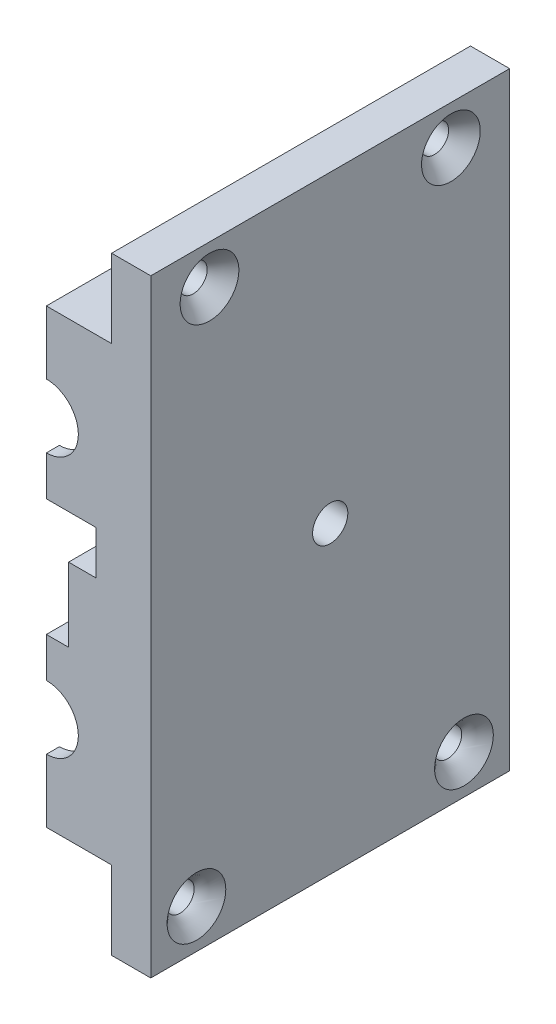
from build123d import *

# Parameters (mm, degrees)
BOSS_EXTRUDE1_DEPTH = 55
BOSS_EXTRUDE2_START = 2
BOSS_EXTRUDE2_DEPTH = 2
BOSS_EXTRUDE3_START = 2
BOSS_EXTRUDE3_DEPTH = 2
BOSS_EXTRUDE5_START = 2
BOSS_EXTRUDE5_DEPTH = 2
BOSS_EXTRUDE6_DEPTH = 2
SKETCH7_W           = 3.4
SKETCH7_H           = 11.3
CUT_EXTRUDE2_DEPTH  = 55
SKETCH8_R           = 2.15
CUT_EXTRUDE3_DEPTH  = 6
CUT_EXTRUDE4_REACH  = 111.395
SKETCH9_R           = 2.7
LPATTERN1_COUNT     = 2
LPATTERN1_PITCH     = 37
LPATTERN2_COUNT     = 2
LPATTERN2_PITCH     = 41


with BuildPart() as part:
    # Sketch1 → Boss-Extrude1 (new body)
    with BuildSketch(Plane.XY):
        with BuildLine():
            Line((0, 0), (0, -93.2))
            Line((0, -93.2), (-6, -93.2))
            Line((-6, -93.2), (-6, -81.2))
            Line((-6, -81.2), (-16, -81.2))
            Line((-16, -81.2), (-16, -74.2))
            ThreePointArc((-16, -74.2), (-8.4, -66.6), (-16, -59))
            Line((-16, -59), (-16, -44.3))
            Line((-16, -44.3), (-8.4, -44.3))
            Line((-8.4, -44.3), (-8.4, -37.6))
            Line((-8.4, -37.6), (-16, -37.6))
            Line((-16, -37.6), (-16, -34.2))
            ThreePointArc((-16, -34.2), (-8.4, -26.6), (-16, -19))
            Line((-16, -19), (-16, -12))
            Line((-16, -12), (-6, -12))
            Line((-6, -12), (-6, 0))
            Line((-6, 0), (0, 0))
        make_face()
    extrude(amount=BOSS_EXTRUDE1_DEPTH)

    # Sketch2 → Boss-Extrude2 (add)
    with BuildSketch(Plane(origin=(0, 0, 28.5), x_dir=(-1, 0, 0), z_dir=(0, 0, -1)).offset(BOSS_EXTRUDE2_START)):
        with BuildLine():
            Line((16, -34.2), (16, -31.5))
            ThreePointArc((16, -31.5), (11.1, -26.6), (16, -21.7))
            Line((16, -21.7), (16, -19))
            ThreePointArc((16, -19), (8.4, -26.6), (16, -34.2))
        make_face()
    extrude(amount=-BOSS_EXTRUDE2_DEPTH)

    # Sketch3 → Boss-Extrude3 (add)
    with BuildSketch(Plane(origin=(0, 0, 28.5), x_dir=(-1, 0, 0), z_dir=(0, 0, -1)).offset(BOSS_EXTRUDE3_START)):
        with BuildLine():
            Line((16, -74.2), (16, -71.5))
            ThreePointArc((16, -71.5), (11.1, -66.6), (16, -61.7))
            Line((16, -61.7), (16, -59))
            ThreePointArc((16, -59), (8.4, -66.6), (16, -74.2))
        make_face()
    extrude(amount=-BOSS_EXTRUDE3_DEPTH)

    # Sketch4 → Boss-Extrude5 (add)
    with BuildSketch(Plane(origin=(0, 0, 2), x_dir=(-1, 0, 0), z_dir=(0, 0, -1)).offset(BOSS_EXTRUDE5_START)):
        with BuildLine():
            Line((16, -59), (16, -61.7))
            ThreePointArc((16, -61.7), (11.1, -66.6), (16, -71.5))
            Line((16, -71.5), (16, -74.2))
            ThreePointArc((16, -74.2), (8.4, -66.6), (16, -59))
        make_face()
        with BuildLine():
            Line((16, -19), (16, -21.7))
            ThreePointArc((16, -21.7), (11.1, -26.6), (16, -31.5))
            Line((16, -31.5), (16, -34.2))
            ThreePointArc((16, -34.2), (8.4, -26.6), (16, -19))
        make_face()
    extrude(amount=-BOSS_EXTRUDE5_DEPTH)

    # Sketch5 → Boss-Extrude6 (add)
    with BuildSketch(Plane(origin=(0, 0, 53), x_dir=(-1, 0, 0), z_dir=(0, 0, -1))):
        with BuildLine():
            Line((16, -19), (16, -21.7))
            ThreePointArc((16, -21.7), (11.1, -26.6), (16, -31.5))
            Line((16, -31.5), (16, -34.2))
            ThreePointArc((16, -34.2), (8.4, -26.6), (16, -19))
        make_face()
        with BuildLine():
            Line((16, -59), (16, -61.7))
            ThreePointArc((16, -61.7), (11.1, -66.6), (16, -71.5))
            Line((16, -71.5), (16, -74.2))
            ThreePointArc((16, -74.2), (8.4, -66.6), (16, -59))
        make_face()
    extrude(amount=-BOSS_EXTRUDE6_DEPTH)

    # Sketch7 → Cut-Extrude2 (cut)
    with BuildSketch(Plane.XY.offset(55)):
        with Locations((-14.3, -49.95)):
            Rectangle(SKETCH7_W, SKETCH7_H)
    extrude(amount=-CUT_EXTRUDE2_DEPTH, mode=Mode.SUBTRACT)

    # Sketch8 → Cut-Extrude3 (cut)
    with BuildSketch(Plane(origin=(0, 0, 0), x_dir=(0, 0, -1), z_dir=(1, 0, 0))):
        with Locations(Location((-46, -6, 0), (0, 0, 90))):
            Circle(SKETCH8_R)
        with Locations(Location((-9, -6, 0), (0, 0, 90))):
            Circle(SKETCH8_R)
        with Locations(Location((-7, -87.2, 0), (0, 0, 90))):
            Circle(SKETCH8_R)
        with Locations(Location((-48, -87.2, 0), (0, 0, 90))):
            Circle(SKETCH8_R)
    extrude(amount=-CUT_EXTRUDE3_DEPTH, mode=Mode.SUBTRACT)

    # Cut-Extrude4: up to this face of the body (flat: up to its plane)
    cut_extrude4_end = Plane(part.part.faces().sort_by_distance((-12.6, -49.95, 27.5))[0])
    # Sketch9 → Cut-Extrude4 (cut, up to the picked face)
    with BuildSketch(Plane(origin=(0, 0, 0), x_dir=(0, 0, -1), z_dir=(1, 0, 0)), mode=Mode.PRIVATE) as cut_extrude4_sk1:
        with Locations(Location((-27.5, -46.6, 0), (0, 0, 90))):
            Circle(SKETCH9_R)
    cut_extrude4_tool1 = split(extrude(cut_extrude4_sk1.sketch, amount=-CUT_EXTRUDE4_REACH, mode=Mode.PRIVATE), bisect_by=cut_extrude4_end, keep=Keep.BOTH, mode=Mode.PRIVATE)
    add(cut_extrude4_tool1.solids().sort_by(Axis((0, -46.6, 27.5), (-1, 0, 0)))[0], mode=Mode.SUBTRACT)

    # Cut-Loft1: read off the stored shape, not the designer's step
    # Cut-Loft1: loft between two sections, ruled curve by curve
    cut_loft1_from = [
        Edge.make_bspline([(0, -9.090752309, 49.270665095), (0, -2.54942212, 55.452169714), (0, 3.632082499, 48.910839524), (0, -2.909247691, 42.729334905), (0, -9.45057788, 36.547830286), (0, -15.632082499, 43.089160476), (0, -9.090752309, 49.270665095)], [0, 0, 0, 0, 0.5, 0.5, 0.5, 1, 1, 1, 1], 3, [1, 0.333333333, 0.333333333, 1, 0.333333333, 0.333333333, 1]),
    ]
    cut_loft1_to = [
        Edge.make_bspline([(-2.5, -7.797727139, 47.179269746), (-2.5, -5.439187646, 50.774724024), (-2.5, -1.843733369, 48.416184531), (-2.5, -4.202272861, 44.820730254), (-2.5, -6.560812354, 41.225275976), (-2.5, -10.156266631, 43.583815469), (-2.5, -7.797727139, 47.179269746)], [0, 0, 0, 0, 0.5, 0.5, 0.5, 1, 1, 1, 1], 3, [1, 0.333333333, 0.333333333, 1, 0.333333333, 0.333333333, 1]),
    ]
    cut_loft1 = Solid(Shell([*[Face.make_surface_from_curves(cut_loft1_from[k], cut_loft1_to[k]) for k in range(1)], Face(Wire(cut_loft1_from)), Face(Wire(cut_loft1_to))]))
    add(cut_loft1, mode=Mode.SUBTRACT)

    # LPattern1: Cut-Loft1 ×2
    with Locations(*[(0, 0, -i * LPATTERN1_PITCH) for i in range(1, LPATTERN1_COUNT)]):
        add(cut_loft1, mode=Mode.SUBTRACT)

    # Cut-Loft2: read off the stored shape, not the designer's step
    # Cut-Loft2: loft between two sections, ruled curve by curve
    cut_loft2_from = [
        Edge.make_bspline([(-2.5, -88.803773463, 46.568074485), (-2.5, -85.939922433, 43.36052756), (-2.5, -82.732375507, 46.22437859), (-2.5, -85.596226537, 49.431925515), (-2.5, -88.460077567, 52.63947244), (-2.5, -91.667624493, 49.77562141), (-2.5, -88.803773463, 46.568074485)], [0, 0, 0, 0, 0.5, 0.5, 0.5, 1, 1, 1, 1], 3, [1, 0.333333333, 0.333333333, 1, 0.333333333, 0.333333333, 1]),
    ]
    cut_loft2_to = [
        Edge.make_bspline([(0, -88.245004687, 43.623018711), (0, -79.491042109, 41.533009337), (0, -77.401032735, 50.286971915), (0, -86.154995313, 52.376981289), (0, -94.908957891, 54.466990663), (0, -96.998967265, 45.713028085), (0, -88.245004687, 43.623018711)], [0, 0, 0, 0, 0.5, 0.5, 0.5, 1, 1, 1, 1], 3, [1, 0.333333333, 0.333333333, 1, 0.333333333, 0.333333333, 1]),
    ]
    cut_loft2 = Solid(Shell([*[Face.make_surface_from_curves(cut_loft2_from[k], cut_loft2_to[k]) for k in range(1)], Face(Wire(cut_loft2_from)), Face(Wire(cut_loft2_to))]))
    add(cut_loft2, mode=Mode.SUBTRACT)

    # LPattern2: Cut-Loft2 ×2
    with Locations(*[(0, 0, -i * LPATTERN2_PITCH) for i in range(1, LPATTERN2_COUNT)]):
        add(cut_loft2, mode=Mode.SUBTRACT)


solid = part.part
